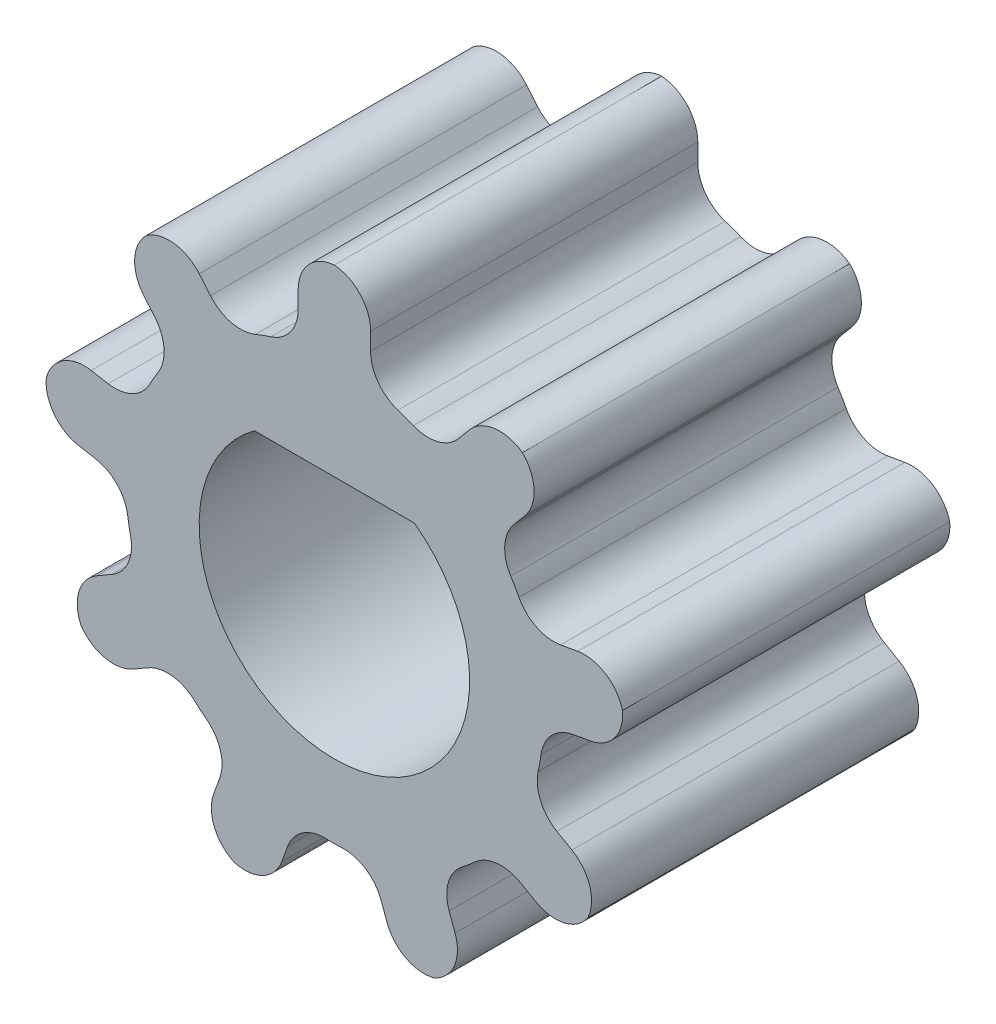
from build123d import *

# Parameters (mm, degrees)
SKETCH1_R                = 2.389889751
SKETCH1_R_2              = 1.55
BOSS_EXTRUDE1_DEPTH      = 3.75
SKETCH2_W                = 0.83
SKETCH2_H                = 1
BOSS_EXTRUDE2_DEPTH      = 3.75
FILLET1_R                = 0.45
CIRPATTERN1_COUNT        = 9
FILLET1_OF_CIRPATTERN1_R = 0.45
SKETCH3_W                = 1.833030278
SKETCH3_H                = 0.3
BOSS_EXTRUDE3_DEPTH      = 3.75


with BuildPart() as part:
    # Sketch1 → Boss-Extrude1 (new body)
    with BuildSketch(Plane.XY):
        Circle(SKETCH1_R)
        Circle(SKETCH1_R_2, mode=Mode.SUBTRACT)
    extrude(amount=BOSS_EXTRUDE1_DEPTH)

    # Sketch2 → Boss-Extrude2 (add)
    with BuildSketch(Plane.XY.offset(3.75)):
        with Locations((0, 2.853581955)):
            Rectangle(SKETCH2_W, SKETCH2_H)
    boss_extrude2 = extrude(amount=-BOSS_EXTRUDE2_DEPTH)

    # Fillet1
    # the kernel refuses this fillet: 0.45 mm, written as the material it adds along each edge
    with BuildSketch(Plane(origin=(-0.415, 2.353581955, 3.75), x_dir=(-0.970855819199755, -0.2396643034036823, 0), z_dir=(0, 0, -1))) as fillet1_piece_1:
        with BuildLine():
            CenterArc((0.352674994, 0.448975623), FILLET1_R, 193.866728132, 72.266543736)
            Line((-0.084210125, 0.341126687), (0, 0))
            ThreePointArc((0, 0), (0.161164415, 0.005440327), (0.32232883, 0))
        make_face()
    extrude(amount=3.75)
    with BuildSketch(Plane(origin=(0.415, 2.353581955, 3.75), x_dir=(0.9708558191997549, -0.2396643034036833, 0), z_dir=(0, 0, -1))) as fillet1_piece_2:
        with BuildLine():
            CenterArc((0.352674994, -0.448975623), FILLET1_R, 93.866728132, 72.266543736)
            Line((-0.084210125, -0.341126687), (0, 0))
            ThreePointArc((0, 0), (0.161164415, -0.005440327), (0.32232883, 0))
        make_face()
    extrude(amount=3.75)
    # the kernel refuses this fillet: 0.45 mm, written as the material it takes off along each edge
    with BuildSketch(Plane(origin=(-0.415, 3.353581955, 4.875), x_dir=(1, 0, 0), z_dir=(0, 0, -1)), Plane(origin=(0.415, 3.353581955, 4.875), x_dir=(0, -1, 0), z_dir=(0, 0, -1))) as fillet1_2_piece_1:
        with BuildLine():
            CenterArc((FILLET1_R, FILLET1_R), FILLET1_R, 180, 90)
            Line((0, FILLET1_R), (0, 0))
            Line((0, 0), (FILLET1_R, 0))
        make_face()
    extrude(amount=6, mode=Mode.SUBTRACT)

    # CirPattern1: Boss-Extrude2 ×9 about axis
    cirpattern1_axis = Axis((0, 0, 0), (0, 0, 1))
    for i in range(1, CIRPATTERN1_COUNT):
        add(boss_extrude2.rotate(cirpattern1_axis, i * 360 / CIRPATTERN1_COUNT))

    # Fillet1 of CirPattern1
    # the kernel refuses this fillet: 0.45 mm, written as the material it adds along each edge
    with BuildSketch(Plane(origin=(-1.830761763, 1.53619152, 3.75), x_dir=(-0.5896654606556537, -0.8076475992100489, 0), z_dir=(0, 0, -1)), Plane(origin=(-2.389889751, 0, 3.75), x_dir=(0.06743592033084408, -0.9977236073428011, 0), z_dir=(0, 0, -1)), Plane(origin=(-1.830761763, -1.53619152, 3.75), x_dir=(0.6929832847277674, -0.7209536511370993, 0), z_dir=(0, 0, -1)), Plane(origin=(-0.415, -2.353581955, 3.75), x_dir=(0.994276068549242, -0.10684146905702349, 0), z_dir=(0, 0, -1)), Plane(origin=(1.194944875, -2.069705236, 3.75), x_dir=(0.8303360297488931, 0.5572630238054965, 0), z_dir=(0, 0, -1)), Plane(origin=(2.245761763, -0.817390435, 3.75), x_dir=(0.2778725344719876, 0.960617954540781, 0), z_dir=(0, 0, -1)), Plane(origin=(2.245761763, 0.817390435, 3.75), x_dir=(-0.4046106078935896, 0.9144890682670732, 0), z_dir=(0, 0, -1)), Plane(origin=(1.194944875, 2.069705236, 3.75), x_dir=(-0.8977719500797382, 0.44046058353730577, 0), z_dir=(0, 0, -1))) as fillet1_of_cirpattern1_piece_1:
        with BuildLine():
            CenterArc((0.352674994, 0.448975623), FILLET1_OF_CIRPATTERN1_R, 193.866728132, 72.266543736)
            Line((-0.084210125, 0.341126687), (0, 0))
            ThreePointArc((0, 0), (0.161164415, 0.005440327), (0.32232883, 0))
        make_face()
    extrude(amount=3.75)
    with BuildSketch(Plane(origin=(-1.194944875, 2.069705236, 3.75), x_dir=(-0.6427876096865393, 0.7660444431189779, 0), z_dir=(0, 0, -1)), Plane(origin=(-2.245761763, 0.817390435, 3.75), x_dir=(-0.9848077530122081, 0.17364817766693041, 0), z_dir=(0, 0, -1)), Plane(origin=(-2.245761763, -0.817390435, 3.75), x_dir=(-0.8660254037844392, -0.4999999999999993, 0), z_dir=(0, 0, -1)), Plane(origin=(-1.194944875, -2.069705236, 3.75), x_dir=(-0.34202014332566916, -0.9396926207859083, 0), z_dir=(0, 0, -1)), Plane(origin=(0.415, -2.353581955, 3.75), x_dir=(0.3420201433256687, -0.9396926207859083, 0), z_dir=(0, 0, -1)), Plane(origin=(1.830761763, -1.53619152, 3.75), x_dir=(0.8660254037844389, -0.49999999999999944, 0), z_dir=(0, 0, -1)), Plane(origin=(2.389889751, 0, 3.75), x_dir=(0.984807753012208, 0.1736481776669301, 0), z_dir=(0, 0, -1))) as fillet1_of_cirpattern1_piece_2:
        with BuildLine():
            CenterArc((0.35136699, 0.45), FILLET1_OF_CIRPATTERN1_R, 197.733456264, 72.266543736)
            ThreePointArc((-0.077250714, 0.31293482), (-0.033343584, 0.157771262), (0, 0))
            Line((0, 0), (0.35136699, 0))
        make_face()
    extrude(amount=3.75)
    with BuildSketch(Plane(origin=(1.830761763, 1.53619152, 3.75), x_dir=(0.5896654606556527, -0.8076475992100495, 0), z_dir=(0, 0, -1))) as fillet1_of_cirpattern1_piece_3:
        with BuildLine():
            CenterArc((0.352674994, -0.448975623), FILLET1_OF_CIRPATTERN1_R, 93.866728132, 72.266543736)
            Line((-0.084210125, -0.341126687), (0, 0))
            ThreePointArc((0, 0), (0.161164415, -0.005440327), (0.32232883, 0))
        make_face()
    extrude(amount=3.75)
    # the kernel refuses this fillet: 0.45 mm, written as the material it takes off along each edge
    with BuildSketch(Plane(origin=(-2.473549373, 2.302235963, 4.875), x_dir=(0.7660444431189787, 0.6427876096865386, 0), z_dir=(0, 0, -1)), Plane(origin=(-1.837732485, 2.835749679, 4.875), x_dir=(0.6427876096865393, -0.766044443118978, 0), z_dir=(0, 0, -1)), Plane(origin=(-3.374697504, 0.173648178, 4.875), x_dir=(0.17364817766693086, 0.984807753012208, 0), z_dir=(0, 0, -1)), Plane(origin=(-3.230569516, 0.991038613, 4.875), x_dir=(0.9848077530122081, -0.17364817766693022, 0), z_dir=(0, 0, -1)), Plane(origin=(-2.696787167, -2.03619152, 4.875), x_dir=(-0.5000000000000001, 0.8660254037844386, 0), z_dir=(0, 0, -1)), Plane(origin=(-3.111787167, -1.317390435, 4.875), x_dir=(0.8660254037844386, 0.5000000000000001, 0), z_dir=(0, 0, -1)), Plane(origin=(-0.757020143, -3.293274576, 4.875), x_dir=(-0.9396926207859084, 0.34202014332566855, 0), z_dir=(0, 0, -1)), Plane(origin=(-1.536965019, -3.009397857, 4.875), x_dir=(0.3420201433256694, 0.9396926207859081, 0), z_dir=(0, 0, -1)), Plane(origin=(1.536965019, -3.009397857, 4.875), x_dir=(-0.9396926207859084, -0.34202014332566855, 0), z_dir=(0, 0, -1)), Plane(origin=(0.757020143, -3.293274576, 4.875), x_dir=(-0.3420201433256689, 0.9396926207859084, 0), z_dir=(0, 0, -1)), Plane(origin=(3.111787167, -1.317390435, 4.875), x_dir=(-0.5000000000000004, -0.8660254037844384, 0), z_dir=(0, 0, -1)), Plane(origin=(2.696787167, -2.03619152, 4.875), x_dir=(-0.8660254037844384, 0.5000000000000004, 0), z_dir=(0, 0, -1)), Plane(origin=(3.230569516, 0.991038613, 4.875), x_dir=(0.17364817766692991, -0.9848077530122081, 0), z_dir=(0, 0, -1)), Plane(origin=(3.374697504, 0.173648178, 4.875), x_dir=(-0.9848077530122081, -0.17364817766692986, 0), z_dir=(0, 0, -1)), Plane(origin=(1.837732485, 2.835749679, 4.875), x_dir=(0.766044443118978, -0.6427876096865394, 0), z_dir=(0, 0, -1)), Plane(origin=(2.473549373, 2.302235963, 4.875), x_dir=(-0.6427876096865394, -0.766044443118978, 0), z_dir=(0, 0, -1))) as fillet1_of_cirpattern1_2_piece_1:
        with BuildLine():
            CenterArc((FILLET1_OF_CIRPATTERN1_R, FILLET1_OF_CIRPATTERN1_R), FILLET1_OF_CIRPATTERN1_R, 180, 90)
            Line((0, FILLET1_OF_CIRPATTERN1_R), (0, 0))
            Line((0, 0), (FILLET1_OF_CIRPATTERN1_R, 0))
        make_face()
    extrude(amount=6, mode=Mode.SUBTRACT)

    # Sketch3 → Boss-Extrude3 (add)
    with BuildSketch(Plane(origin=(0, 0, 0), x_dir=(-1, 0, 0), z_dir=(0, 0, -1))):
        with Locations((0, 1.4)):
            Rectangle(SKETCH3_W, SKETCH3_H)
    extrude(amount=-BOSS_EXTRUDE3_DEPTH)


solid = part.part
